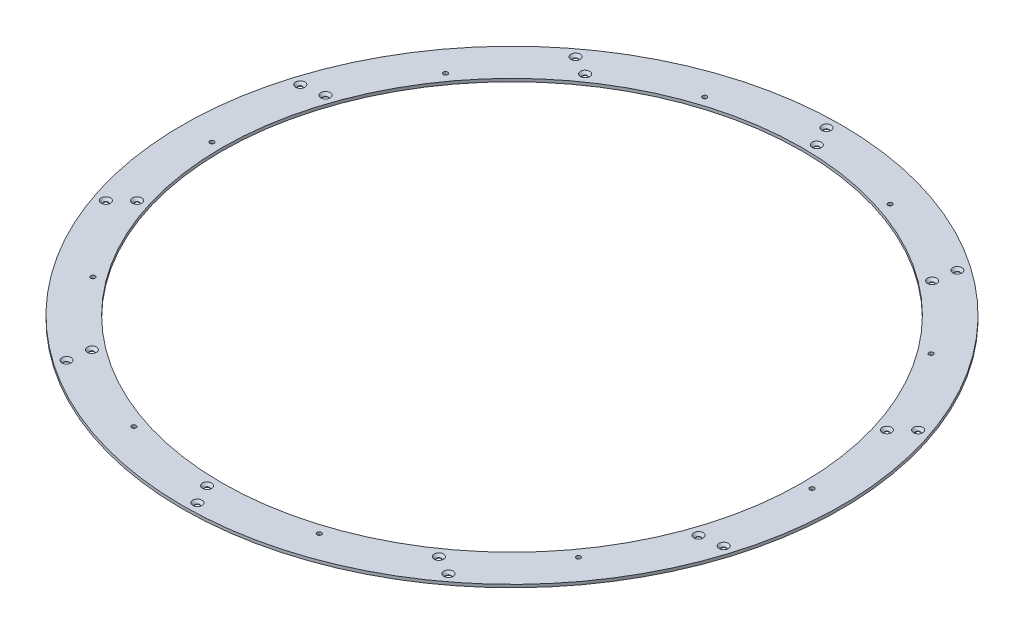
from build123d import *

# Parameters (mm, degrees)
SKETCH1_R                                      = 335
SKETCH1_R_2                                    = 295
BOSS_EXTRUDE1_DEPTH                            = 3
CBORE_FOR_M4_SHCS1_D                           = 4.5
CBORE_FOR_M4_SHCS1_CBORE_D                     = 8
CBORE_FOR_M4_SHCS1_CBORE_DEPTH                 = 4
CSK_FOR_M4_FLAT_HEAD_MACHINE_SCREW1_AT_2_COUNT = 2
CSK_FOR_M4_FLAT_HEAD_MACHINE_SCREW1_AT_2_PITCH = 200.861046344
CSK_FOR_M4_FLAT_HEAD_MACHINE_SCREW1_AT_3_COUNT = 2
CSK_FOR_M4_FLAT_HEAD_MACHINE_SCREW1_AT_3_PITCH = 382.06041399
CSK_FOR_M4_FLAT_HEAD_MACHINE_SCREW1_AT_4_COUNT = 2
CSK_FOR_M4_FLAT_HEAD_MACHINE_SCREW1_AT_4_PITCH = 525.861046344
CSK_FOR_M4_FLAT_HEAD_MACHINE_SCREW1_AT_5_COUNT = 2
CSK_FOR_M4_FLAT_HEAD_MACHINE_SCREW1_AT_5_PITCH = 618.186735592
CSK_FOR_M4_FLAT_HEAD_MACHINE_SCREW1_AT_6_COUNT = 2
CSK_FOR_M4_FLAT_HEAD_MACHINE_SCREW1_AT_6_PITCH = 650
CSK_FOR_M4_FLAT_HEAD_MACHINE_SCREW1_AT_7_COUNT = 2
CSK_FOR_M4_FLAT_HEAD_MACHINE_SCREW1_AT_7_PITCH = 618.186735592
CSK_FOR_M4_FLAT_HEAD_MACHINE_SCREW1_AT_8_COUNT = 2
CSK_FOR_M4_FLAT_HEAD_MACHINE_SCREW1_AT_8_PITCH = 525.861046344
CSK_FOR_M4_FLAT_HEAD_MACHINE_SCREW1_AT_9_COUNT = 2
CSK_FOR_M4_FLAT_HEAD_MACHINE_SCREW1_AT_9_PITCH = 382.06041399
CSK_FOR_M4_FLAT_HEAD_MACHINE_SCREW1_AT_1_COUNT = 2
CSK_FOR_M4_FLAT_HEAD_MACHINE_SCREW1_AT_1_PITCH = 200.861046344
CSK_FOR_M4_FLAT_HEAD_MACHINE_SCREW1_2_COUNT    = 2
CSK_FOR_M4_FLAT_HEAD_MACHINE_SCREW1_2_PITCH    = 22.427967191
CSK_FOR_M4_FLAT_HEAD_MACHINE_SCREW1_3_COUNT    = 2
CSK_FOR_M4_FLAT_HEAD_MACHINE_SCREW1_3_PITCH    = 205.187160438
CSK_FOR_M4_FLAT_HEAD_MACHINE_SCREW1_4_COUNT    = 2
CSK_FOR_M4_FLAT_HEAD_MACHINE_SCREW1_4_PITCH    = 378.80949114
CSK_FOR_M4_FLAT_HEAD_MACHINE_SCREW1_5_COUNT    = 2
CSK_FOR_M4_FLAT_HEAD_MACHINE_SCREW1_5_PITCH    = 515.711356159
CSK_FOR_M4_FLAT_HEAD_MACHINE_SCREW1_6_COUNT    = 2
CSK_FOR_M4_FLAT_HEAD_MACHINE_SCREW1_6_PITCH    = 602.254372662
CSK_FOR_M4_FLAT_HEAD_MACHINE_SCREW1_7_COUNT    = 2
CSK_FOR_M4_FLAT_HEAD_MACHINE_SCREW1_7_PITCH    = 629.91823778
CSK_FOR_M4_FLAT_HEAD_MACHINE_SCREW1_8_COUNT    = 2
CSK_FOR_M4_FLAT_HEAD_MACHINE_SCREW1_8_PITCH    = 595.985091417
CSK_FOR_M4_FLAT_HEAD_MACHINE_SCREW1_9_COUNT    = 2
CSK_FOR_M4_FLAT_HEAD_MACHINE_SCREW1_9_PITCH    = 503.789012805
CSK_FOR_M4_FLAT_HEAD_MACHINE_SCREW1_10_COUNT   = 2
CSK_FOR_M4_FLAT_HEAD_MACHINE_SCREW1_10_PITCH   = 362.411088584
CSK_FOR_M4_FLAT_HEAD_MACHINE_SCREW1_11_COUNT   = 2
CSK_FOR_M4_FLAT_HEAD_MACHINE_SCREW1_11_PITCH   = 185.982984731


with BuildPart() as part:
    # Sketch1 → Boss-Extrude1 (new body)
    with BuildSketch(Plane(origin=(0, 0, 0), x_dir=(1, 0, 0), z_dir=(0, 1, 0))):
        Circle(SKETCH1_R)
        Circle(SKETCH1_R_2, mode=Mode.SUBTRACT)
    extrude(amount=BOSS_EXTRUDE1_DEPTH)

    # CBORE for M4 SHCS1 (through all)
    with Locations(Plane(origin=(-241.919898461, 27, -82.731546664), x_dir=(-0.7310042148360869, 0, -0.6823729463364416), z_dir=(0, 1, 0))):
        with Locations((-104.258068577, -380.960288037), (33.536493883, -252.332737516), (69.409259411, -67.27725154), (-10.341949154, 103.521264053), (-175.254880785, 194.823581535), (-362.338400782, 171.755318879), (-500.132963242, 43.127768358), (-536.00572877, -141.927717619), (-456.254520205, -312.726233212), (-291.341588574, -404.028550694)):
            CounterBoreHole(CBORE_FOR_M4_SHCS1_D / 2, CBORE_FOR_M4_SHCS1_CBORE_D / 2, CBORE_FOR_M4_SHCS1_CBORE_DEPTH)

    # Sketch5 → CSK for M4 Flat Head Machine Screw1 (revolve, cut)
    with BuildSketch(Plane(origin=(-307.434418553, 3, 105.399612377), x_dir=(0, 0, 1), z_dir=(1, 0, 0))):
        Polygon((0, 0), (0, 3), (2.25, 3), (2.25, 2.45), (4.7, 0), align=None)
    csk_for_m4_flat_head_machine_screw1 = revolve(axis=Axis((-307.434418553, 9.35, 105.399612377), (0, -1, 0)), mode=Mode.SUBTRACT)

    # CSK for M4 Flat Head Machine Screw1 at 2: CSK for M4 Flat Head Machine Screw1 ×2
    with Locations(*[Vector(-0.01611854823806712, 0, -0.9998700877627539) * (i * CSK_FOR_M4_FLAT_HEAD_MACHINE_SCREW1_AT_2_PITCH) for i in range(1, CSK_FOR_M4_FLAT_HEAD_MACHINE_SCREW1_AT_2_COUNT)]):
        add(csk_for_m4_flat_head_machine_screw1, mode=Mode.SUBTRACT)

    # CSK for M4 Flat Head Machine Screw1 at 3: CSK for M4 Flat Head Machine Screw1 ×2
    with Locations(*[Vector(0.29364719895082986, 0, -0.9559138677455892) * (i * CSK_FOR_M4_FLAT_HEAD_MACHINE_SCREW1_AT_3_PITCH) for i in range(1, CSK_FOR_M4_FLAT_HEAD_MACHINE_SCREW1_AT_3_COUNT)]):
        add(csk_for_m4_flat_head_machine_screw1, mode=Mode.SUBTRACT)

    # CSK for M4 Flat Head Machine Screw1 at 4: CSK for M4 Flat Head Machine Screw1 ×2
    with Locations(*[Vector(0.5746687123460797, 0, -0.8183861381099381) * (i * CSK_FOR_M4_FLAT_HEAD_MACHINE_SCREW1_AT_4_PITCH) for i in range(1, CSK_FOR_M4_FLAT_HEAD_MACHINE_SCREW1_AT_4_COUNT)]):
        add(csk_for_m4_flat_head_machine_screw1, mode=Mode.SUBTRACT)

    # CSK for M4 Flat Head Machine Screw1 at 5: CSK for M4 Flat Head Machine Screw1 ×2
    with Locations(*[Vector(0.7994376482245384, 0, -0.6007490712445747) * (i * CSK_FOR_M4_FLAT_HEAD_MACHINE_SCREW1_AT_5_PITCH) for i in range(1, CSK_FOR_M4_FLAT_HEAD_MACHINE_SCREW1_AT_5_COUNT)]):
        add(csk_for_m4_flat_head_machine_screw1, mode=Mode.SUBTRACT)

    # CSK for M4 Flat Head Machine Screw1 at 6: CSK for M4 Flat Head Machine Screw1 ×2
    with Locations(*[Vector(0.94595205708516, 0, -0.32430649962089014) * (i * CSK_FOR_M4_FLAT_HEAD_MACHINE_SCREW1_AT_6_PITCH) for i in range(1, CSK_FOR_M4_FLAT_HEAD_MACHINE_SCREW1_AT_6_COUNT)]):
        add(csk_for_m4_flat_head_machine_screw1, mode=Mode.SUBTRACT)

    # CSK for M4 Flat Head Machine Screw1 at 7: CSK for M4 Flat Head Machine Screw1 ×2
    with Locations(*[Vector(0.999870087762754, 0, -0.0161185482380638) * (i * CSK_FOR_M4_FLAT_HEAD_MACHINE_SCREW1_AT_7_PITCH) for i in range(1, CSK_FOR_M4_FLAT_HEAD_MACHINE_SCREW1_AT_7_COUNT)]):
        add(csk_for_m4_flat_head_machine_screw1, mode=Mode.SUBTRACT)

    # CSK for M4 Flat Head Machine Screw1 at 8: CSK for M4 Flat Head Machine Screw1 ×2
    with Locations(*[Vector(0.9559138677455881, 0, 0.2936471989508337) * (i * CSK_FOR_M4_FLAT_HEAD_MACHINE_SCREW1_AT_8_PITCH) for i in range(1, CSK_FOR_M4_FLAT_HEAD_MACHINE_SCREW1_AT_8_COUNT)]):
        add(csk_for_m4_flat_head_machine_screw1, mode=Mode.SUBTRACT)

    # CSK for M4 Flat Head Machine Screw1 at 9: CSK for M4 Flat Head Machine Screw1 ×2
    with Locations(*[Vector(0.8183861381099359, 0, 0.5746687123460829) * (i * CSK_FOR_M4_FLAT_HEAD_MACHINE_SCREW1_AT_9_PITCH) for i in range(1, CSK_FOR_M4_FLAT_HEAD_MACHINE_SCREW1_AT_9_COUNT)]):
        add(csk_for_m4_flat_head_machine_screw1, mode=Mode.SUBTRACT)

    # CSK for M4 Flat Head Machine Screw1 at 1: CSK for M4 Flat Head Machine Screw1 ×2
    with Locations(*[Vector(0.6007490712445773, 0, 0.7994376482245364) * (i * CSK_FOR_M4_FLAT_HEAD_MACHINE_SCREW1_AT_1_PITCH) for i in range(1, CSK_FOR_M4_FLAT_HEAD_MACHINE_SCREW1_AT_1_COUNT)]):
        add(csk_for_m4_flat_head_machine_screw1, mode=Mode.SUBTRACT)

    # CSK for M4 Flat Head Machine Screw1  2: CSK for M4 Flat Head Machine Screw1 ×2
    with Locations(*[Vector(0.7080752684749597, 0, -0.7061369655910343) * (i * CSK_FOR_M4_FLAT_HEAD_MACHINE_SCREW1_2_PITCH) for i in range(1, CSK_FOR_M4_FLAT_HEAD_MACHINE_SCREW1_2_COUNT)]):
        add(csk_for_m4_flat_head_machine_screw1, mode=Mode.SUBTRACT)

    # CSK for M4 Flat Head Machine Screw1  3: CSK for M4 Flat Head Machine Screw1 ×2
    with Locations(*[Vector(0.09220382552845001, 0, -0.9957401541355653) * (i * CSK_FOR_M4_FLAT_HEAD_MACHINE_SCREW1_3_PITCH) for i in range(1, CSK_FOR_M4_FLAT_HEAD_MACHINE_SCREW1_3_COUNT)]):
        add(csk_for_m4_flat_head_machine_screw1, mode=Mode.SUBTRACT)

    # CSK for M4 Flat Head Machine Screw1  4: CSK for M4 Flat Head Machine Screw1 ×2
    with Locations(*[Vector(0.348883711676711, 0, -0.9371660235660925) * (i * CSK_FOR_M4_FLAT_HEAD_MACHINE_SCREW1_4_PITCH) for i in range(1, CSK_FOR_M4_FLAT_HEAD_MACHINE_SCREW1_4_COUNT)]):
        add(csk_for_m4_flat_head_machine_screw1, mode=Mode.SUBTRACT)

    # CSK for M4 Flat Head Machine Screw1  5: CSK for M4 Flat Head Machine Screw1 ×2
    with Locations(*[Vector(0.6056693769389987, 0, -0.7957164104367367) * (i * CSK_FOR_M4_FLAT_HEAD_MACHINE_SCREW1_5_PITCH) for i in range(1, CSK_FOR_M4_FLAT_HEAD_MACHINE_SCREW1_5_COUNT)]):
        add(csk_for_m4_flat_head_machine_screw1, mode=Mode.SUBTRACT)

    # CSK for M4 Flat Head Machine Screw1  6: CSK for M4 Flat Head Machine Screw1 ×2
    with Locations(*[Vector(0.81471037414568, 0, -0.5798680938449763) * (i * CSK_FOR_M4_FLAT_HEAD_MACHINE_SCREW1_6_PITCH) for i in range(1, CSK_FOR_M4_FLAT_HEAD_MACHINE_SCREW1_6_COUNT)]):
        add(csk_for_m4_flat_head_machine_screw1, mode=Mode.SUBTRACT)

    # CSK for M4 Flat Head Machine Screw1  7: CSK for M4 Flat Head Machine Screw1 ×2
    with Locations(*[Vector(0.9508982472490711, 0, -0.30950367264160933) * (i * CSK_FOR_M4_FLAT_HEAD_MACHINE_SCREW1_7_PITCH) for i in range(1, CSK_FOR_M4_FLAT_HEAD_MACHINE_SCREW1_7_COUNT)]):
        add(csk_for_m4_flat_head_machine_screw1, mode=Mode.SUBTRACT)

    # CSK for M4 Flat Head Machine Screw1  8: CSK for M4 Flat Head Machine Screw1 ×2
    with Locations(*[Vector(0.9999407779591929, 0, -0.010883040676396807) * (i * CSK_FOR_M4_FLAT_HEAD_MACHINE_SCREW1_8_PITCH) for i in range(1, CSK_FOR_M4_FLAT_HEAD_MACHINE_SCREW1_8_COUNT)]):
        add(csk_for_m4_flat_head_machine_screw1, mode=Mode.SUBTRACT)

    # CSK for M4 Flat Head Machine Screw1  9: CSK for M4 Flat Head Machine Screw1 ×2
    with Locations(*[Vector(0.9581558222776704, 0, 0.28624713140117486) * (i * CSK_FOR_M4_FLAT_HEAD_MACHINE_SCREW1_9_PITCH) for i in range(1, CSK_FOR_M4_FLAT_HEAD_MACHINE_SCREW1_9_COUNT)]):
        add(csk_for_m4_flat_head_machine_screw1, mode=Mode.SUBTRACT)

    # CSK for M4 Flat Head Machine Screw1  10: CSK for M4 Flat Head Machine Screw1 ×2
    with Locations(*[Vector(0.8347378732870561, 0, 0.5506475123890081) * (i * CSK_FOR_M4_FLAT_HEAD_MACHINE_SCREW1_10_PITCH) for i in range(1, CSK_FOR_M4_FLAT_HEAD_MACHINE_SCREW1_10_COUNT)]):
        add(csk_for_m4_flat_head_machine_screw1, mode=Mode.SUBTRACT)

    # CSK for M4 Flat Head Machine Screw1  11: CSK for M4 Flat Head Machine Screw1 ×2
    with Locations(*[Vector(0.6678350280402617, 0, 0.7443093277142662) * (i * CSK_FOR_M4_FLAT_HEAD_MACHINE_SCREW1_11_PITCH) for i in range(1, CSK_FOR_M4_FLAT_HEAD_MACHINE_SCREW1_11_COUNT)]):
        add(csk_for_m4_flat_head_machine_screw1, mode=Mode.SUBTRACT)


solid = part.part
